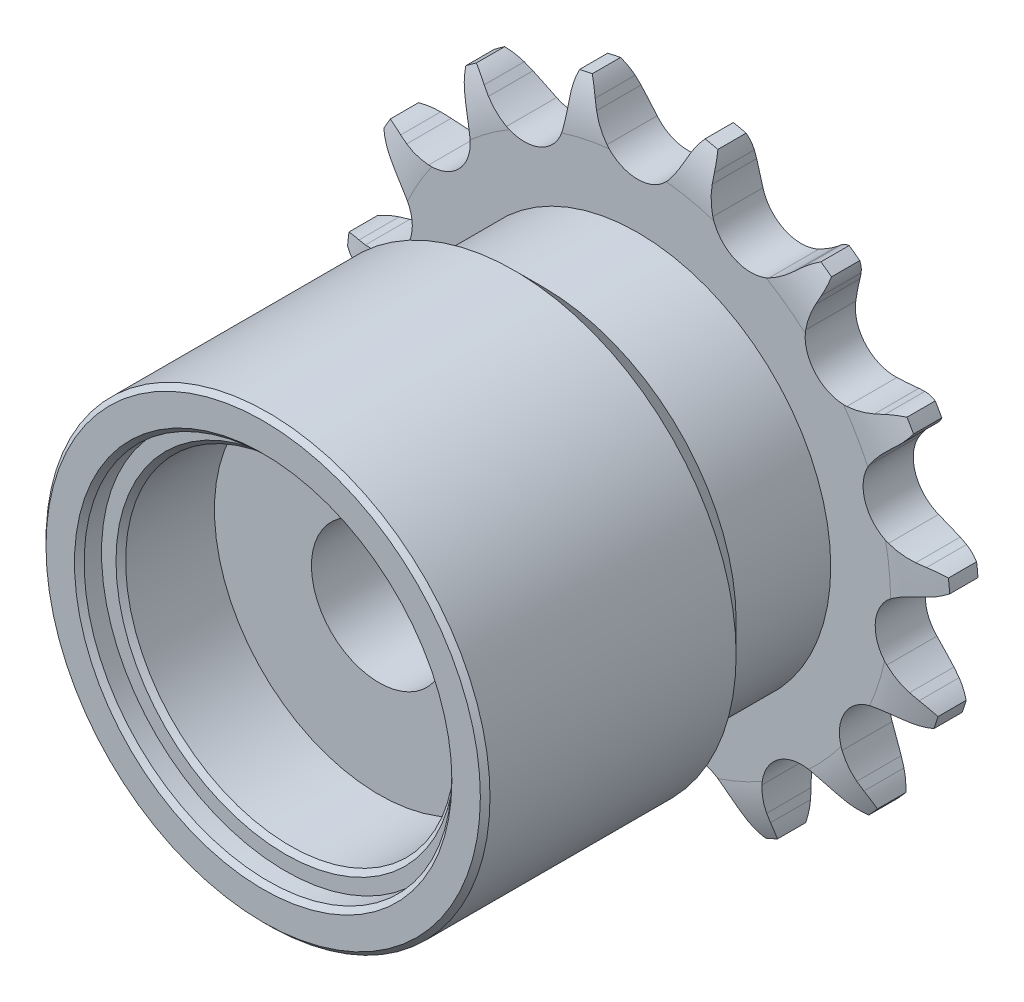
from build123d import *

# Parameters (mm, degrees)
CUT_EXTRUDE1_DEPTH      = 23.54315441
CIRPATTERN1_COUNT       = 15
BOSS_EXTRUDE1_START     = 1.3
SKETCH2_R               = 10
BOSS_EXTRUDE1_DEPTH     = 7.4
CUT_EXTRUDE2_DEPTH      = 25.083300715
CUT_EXTRUDE2_DEPTH_BACK = 25.083300715
SKETCH3_R               = 3
SKETCH4_W               = 1.95
SKETCH4_H               = 5.584687294
CUT_EXTRUDE3_DEPTH      = 25.083300715
CUT_EXTRUDE3_DEPTH_BACK = 25.083300715
SKETCH5_OUTSIDE_W       = 42.85
SKETCH5_OUTSIDE_H       = 42.678
SKETCH5_OUTSIDE_R       = 15.65
CUT_EXTRUDE4_DEPTH      = 24.74557098
CUT_EXTRUDE4_DEPTH_BACK = 24.74557098
SKETCH6_R               = 3.5
BOSS_EXTRUDE2_START     = 12.5
SKETCH7_R               = 11.5
SKETCH7_R_2             = 3.5
BOSS_EXTRUDE2_DEPTH     = 12.5
SKETCH8_R               = 8.525
CUT_EXTRUDE5_DEPTH      = 6
SKETCH9_R               = 9.525
CUT_EXTRUDE6_DEPTH      = 1.15
CHAMFER1_SIZE           = 2
CHAMFER2_SIZE           = 0.25


with BuildPart() as part:
    # Sketch1 → Revolve1 (revolve)
    with BuildSketch(Plane(origin=(0, 0, 0), x_dir=(0, 0, -1), z_dir=(1, 0, 0))):
        with BuildLine():
            Line((1.3, 0), (-1.3, 0))
            Line((-1.3, 0), (-1.3, 13.101418106))
            ThreePointArc((-1.3, 13.101418106), (-1.122370651, 14.550555781), (-0.6, 15.913890328))
            Line((-0.6, 15.913890328), (0.6, 15.913890328))
            ThreePointArc((0.6, 15.913890328), (1.122370651, 14.550555781), (1.3, 13.101418106))
            Line((1.3, 13.101418106), (1.3, 0))
        make_face()
    revolve(axis=Axis((0, 0, -1.3), (0, 0, 1)))

    # Sketch0 → Cut-Extrude1 (cut, symmetric)
    with BuildSketch(Plane.XY):
        with BuildLine():
            Line((5.458731892, -13.819129077), (5.192148114, -13.461913404))
            ThreePointArc((5.192148114, -13.461913404), (4.769815507, -12.963915887), (4.288911093, -12.522217685))
            ThreePointArc((4.288911093, -12.522217685), (2.574176066, -12.110546227), (1.175129538, -13.184072386))
            ThreePointArc((1.175129538, -13.184072386), (0.915456339, -13.78318522), (0.732190143, -14.409906736))
            Line((0.732190143, -14.409906736), (0.633946447, -14.844668882))
            ThreePointArc((0.633946447, -14.844668882), (-0.774190712, -16.881356201), (-3.200657759, -17.374512534))
            ThreePointArc((-3.200657759, -17.374512534), (3.673146461, -17.280795438), (9.99079726, -14.570582212))
            ThreePointArc((9.99079726, -14.570582212), (7.573524561, -15.106994545), (5.458731892, -13.819129077))
        make_face()
    cut_extrude1 = extrude(amount=CUT_EXTRUDE1_DEPTH, both=True, mode=Mode.SUBTRACT)

    # CirPattern1: Cut-Extrude1 ×15 about axis
    cirpattern1_axis = Axis((0, 0, 0), (0, 0, 1))
    for i in range(1, CIRPATTERN1_COUNT):
        add(cut_extrude1.rotate(cirpattern1_axis, i * 360 / CIRPATTERN1_COUNT), mode=Mode.SUBTRACT)

    # Sketch2 → Boss-Extrude1 (add)
    with BuildSketch(Plane.XY.offset(BOSS_EXTRUDE1_START)):
        with Locations(Location((0, 0, 0), (0, 0, 270))):
            Circle(SKETCH2_R)
    extrude(amount=BOSS_EXTRUDE1_DEPTH)

    # Sketch3 → Cut-Extrude2 (cut, two sides: drawn at the far end of the back side and taken through both)
    with BuildSketch(Plane.XY.offset(-CUT_EXTRUDE2_DEPTH_BACK)):
        Circle(SKETCH3_R)
    extrude(amount=CUT_EXTRUDE2_DEPTH + CUT_EXTRUDE2_DEPTH_BACK, mode=Mode.SUBTRACT)

    # Sketch4 → Cut-Revolve1 (revolve, cut)
    with BuildSketch(Plane(origin=(0, 0, 0), x_dir=(0, 0, -1), z_dir=(1, 0, 0))):
        Polygon((-8.7, 10), (-8.7, 9.5), (-8.2, 10), align=None)
        with Locations((-2.275, 13.121546681)):
            Rectangle(SKETCH4_W, SKETCH4_H)
    revolve(axis=Axis((0, 0, -1.3), (0, 0, 1)), mode=Mode.SUBTRACT)

    # Sketch5 outside → Cut-Extrude3 (cut, two sides: drawn at the far end of the back side and taken through both)
    with BuildSketch(Plane.XY.offset(-CUT_EXTRUDE3_DEPTH_BACK)):
        with Locations((0, -0.155)):
            Rectangle(SKETCH5_OUTSIDE_W, SKETCH5_OUTSIDE_H)
        Circle(SKETCH5_OUTSIDE_R, mode=Mode.SUBTRACT)
    extrude(amount=CUT_EXTRUDE3_DEPTH + CUT_EXTRUDE3_DEPTH_BACK, mode=Mode.SUBTRACT)

    # Sketch6 → Cut-Extrude4 (cut, two sides: drawn at the far end of the back side and taken through both)
    with BuildSketch(Plane.XY.offset(-CUT_EXTRUDE4_DEPTH_BACK)):
        with Locations(Location((0, 0, 0), (0, 0, 90))):
            Circle(SKETCH6_R)
    extrude(amount=CUT_EXTRUDE4_DEPTH + CUT_EXTRUDE4_DEPTH_BACK, mode=Mode.SUBTRACT)

    # Sketch7 → Boss-Extrude2 (add)
    with BuildSketch(Plane.XY.offset(8.2).offset(BOSS_EXTRUDE2_START)):
        Circle(SKETCH7_R)
        with Locations(Location((0, 0, 0), (0, 0, 90))):
            Circle(SKETCH7_R_2, mode=Mode.SUBTRACT)
    extrude(amount=-BOSS_EXTRUDE2_DEPTH)

    # Sketch8 → Cut-Extrude5 (cut)
    with BuildSketch(Plane.XY.offset(20.7)):
        Circle(SKETCH8_R)
    extrude(amount=-CUT_EXTRUDE5_DEPTH, mode=Mode.SUBTRACT)

    # Sketch9 → Cut-Extrude6 (cut)
    with BuildSketch(Plane.XY.offset(20.7)):
        Circle(SKETCH9_R)
    extrude(amount=-CUT_EXTRUDE6_DEPTH, mode=Mode.SUBTRACT)

    # Chamfer1
    # the kernel refuses this chamfer: 2 mm, written as the material it adds along each edge
    with BuildSketch(Plane(origin=(0, 0, 8.2), x_dir=(0, -1, 0), z_dir=(1, 0, 0))) as chamfer1_piece_1_section:
        Polygon((10, CHAMFER1_SIZE), (10 + CHAMFER1_SIZE, 0), (10, 0), align=None)
    chamfer1_piece_1 = revolve(axis=Axis((0, 0, 8.2), (0, 0, -1)), mode=Mode.PRIVATE)
    chamfer1_piece_1 = chamfer1_piece_1 & Plane(origin=(0, 0, 6.958008997), x_dir=(1, 0, 0), z_dir=(0, 0, 1)) * Cylinder(11.5, 49, mode=Mode.PRIVATE)
    add(chamfer1_piece_1)

    # Chamfer2
    chamfer2_edges = [part.edges().sort_by_distance(p)[0] for p in [
        (-11.5, 0, 20.7),
        (-9.525, 0, 20.7),
        (-8.525, 0, 19.55),
    ]]
    chamfer(chamfer2_edges, length=CHAMFER2_SIZE)


solid = part.part
